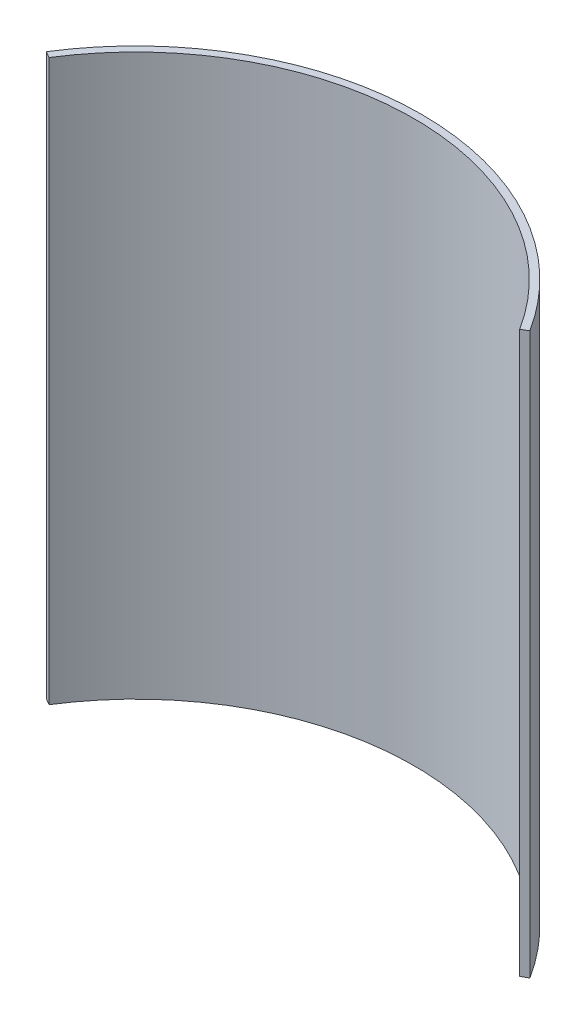
from build123d import *

# Parameters (mm, degrees)
BOSS_EXTRUDE1_DEPTH = 75.5


with BuildPart() as part:
    # Sketch1 → Boss-Extrude1 (new body)
    with BuildSketch(Plane(origin=(0, 0, 0), x_dir=(1, 0, 0), z_dir=(0, 1, 0))):
        with BuildLine():
            Line((-31.699961479, 20.034032101), (-32.566662498, 20.534422167))
            ThreePointArc((-32.566662498, 20.534422167), (0, 38.5), (32.566662498, 20.534422167))
            Line((32.566662498, 20.534422167), (31.699961479, 20.034032101))
            ThreePointArc((31.699961479, 20.034032101), (0, 37.5), (-31.699961479, 20.034032101))
        make_face()
    extrude(amount=-BOSS_EXTRUDE1_DEPTH)


solid = part.part
